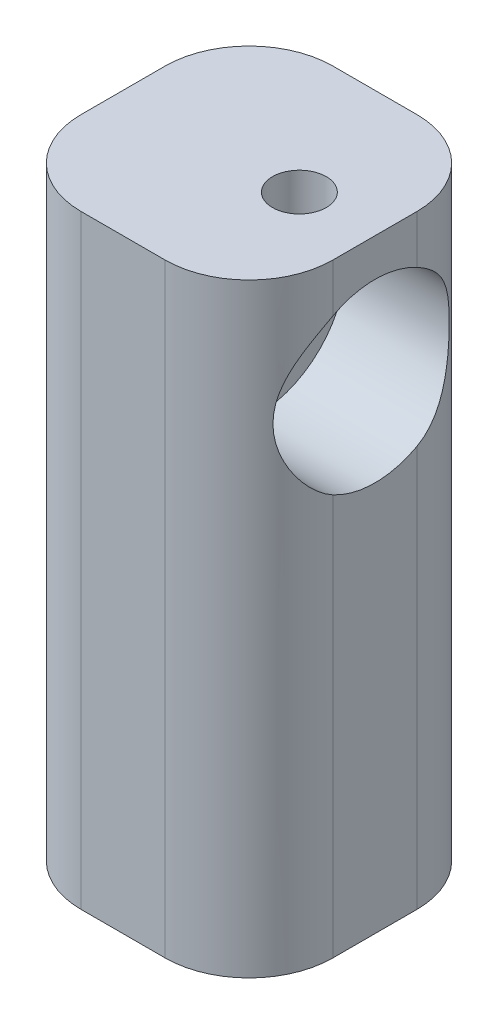
from build123d import *

# Parameters (mm, degrees)
SKETCH1_W               = 15
SKETCH1_H               = 15
SKETCH1_R               = 4.25
BOSS_EXTRUDE1_DEPTH     = 20
SKETCH2_W               = 15
SKETCH2_H               = 15
BOSS_EXTRUDE2_DEPTH     = 16
SKETCH3_R               = 2.5
CUT_EXTRUDE1_DEPTH      = 40.714606885
FILLET1_R               = 5
SKETCH4_R               = 5.25
CUT_EXTRUDE2_DEPTH      = 7
CUT_EXTRUDE3_REACH      = 39.53
CUT_EXTRUDE3_END_RADIUS = 5.25
SKETCH5_R               = 1.6
CHAMFER1_SIZE           = 10
CHAMFER1_SIZE2          = 0.174550649


with BuildPart() as part:
    # Sketch1 → Boss-Extrude1 (new body)
    with BuildSketch(Plane(origin=(0, 0, 0), x_dir=(1, 0, 0), z_dir=(0, 1, 0))):
        Rectangle(SKETCH1_W, SKETCH1_H)
        with Locations(Location((0, 0, 0), (0, 0, 270))):
            Circle(SKETCH1_R, mode=Mode.SUBTRACT)
    extrude(amount=BOSS_EXTRUDE1_DEPTH)

    # Sketch2 → Boss-Extrude2 (add)
    with BuildSketch(Plane(origin=(0, 20, 0), x_dir=(1, 0, 0), z_dir=(0, 1, 0))):
        Rectangle(SKETCH2_W, SKETCH2_H)
    extrude(amount=BOSS_EXTRUDE2_DEPTH)

    # Sketch3 → Cut-Extrude1 (cut, through all)
    with BuildSketch(Plane(origin=(7.5, 0, 0), x_dir=(0, 0, -1), z_dir=(1, 0, 0))):
        with Locations((0, 28.5)):
            Circle(SKETCH3_R)
    extrude(amount=-CUT_EXTRUDE1_DEPTH, mode=Mode.SUBTRACT)

    # Fillet1
    fillet1_edges = [part.edges().sort_by_distance(p)[0] for p in [
        (-7.5, 18, -7.5),
        (7.5, 18, -7.5),
        (7.5, 18, 7.5),
        (-7.5, 18, 7.5),
    ]]
    fillet(fillet1_edges, radius=FILLET1_R - 0.0001)  # a hair under: the kernel refuses the full size

    # Sketch4 → Cut-Extrude2 (cut)
    with BuildSketch(Plane(origin=(7.5, 0, 0), x_dir=(0, 0, -1), z_dir=(1, 0, 0))):
        with Locations((0, 28.5)):
            Circle(SKETCH4_R)
    extrude(amount=-CUT_EXTRUDE2_DEPTH, mode=Mode.SUBTRACT)

    # Cut-Extrude3: up to this cylinder (the profile starts outside it)
    cut_extrude3_end = Plane(origin=(3, 28.5, 0), z_dir=(1, 0, 0)) * Cylinder(CUT_EXTRUDE3_END_RADIUS, 90.56, mode=Mode.PRIVATE)
    # Sketch5 → Cut-Extrude3 (cut, up to the surface)
    with BuildSketch(Plane(origin=(0, 36, 0), x_dir=(1, 0, 0), z_dir=(0, 1, 0)), mode=Mode.PRIVATE) as cut_extrude3_sk1:
        with Locations(Location((3, 0, 0), (0, 0, 270))):
            Circle(SKETCH5_R)
    cut_extrude3_tool1 = extrude(cut_extrude3_sk1.sketch, amount=-CUT_EXTRUDE3_REACH, mode=Mode.PRIVATE) - cut_extrude3_end
    add(cut_extrude3_tool1.solids().sort_by_distance((3, 36, 0))[0], mode=Mode.SUBTRACT)

    # Chamfer1
    chamfer1_edges = [part.edges().sort_by_distance(p)[0] for p in [
        (0, 20, -4.25),
    ]]
    chamfer1_side = [part.faces().sort_by_distance(p)[0] for p in [
        (0, 10, -4.25),
    ]]
    chamfer(chamfer1_edges, length=CHAMFER1_SIZE, length2=CHAMFER1_SIZE2, reference=chamfer1_side[0])


solid = part.part
